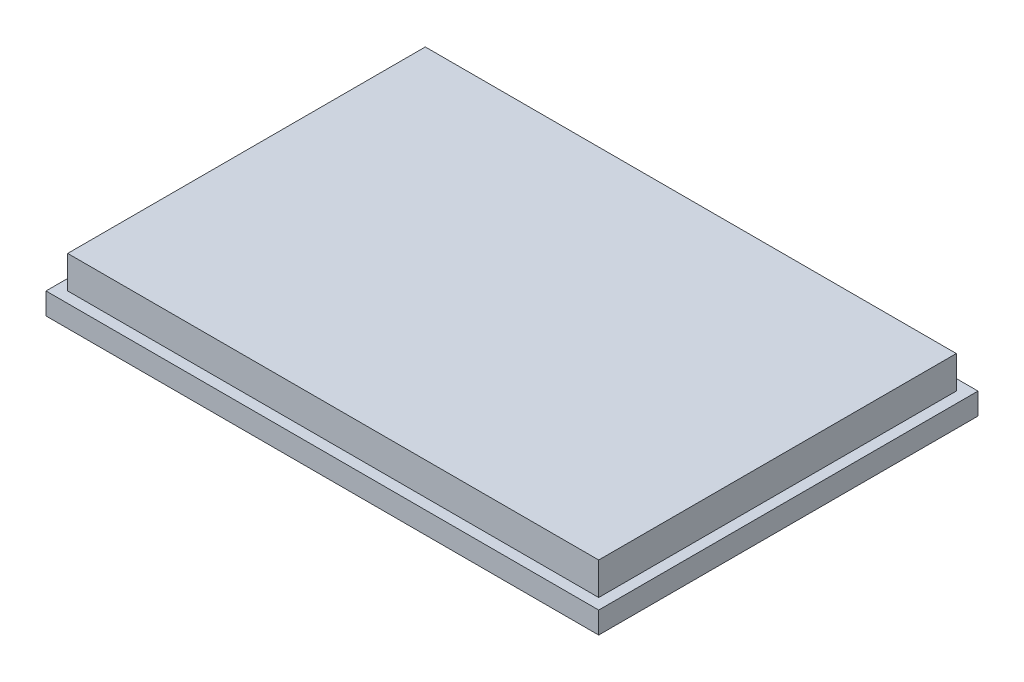
from build123d import *

# Parameters (mm, degrees)
SKETCH1_W           = 51
SKETCH1_H           = 35
BOSS_EXTRUDE1_DEPTH = 2
SKETCH2_W           = 49
SKETCH2_H           = 33
BOSS_EXTRUDE2_DEPTH = 3
SKETCH3_W           = 5.491242003
SKETCH3_H           = 3
BOSS_EXTRUDE3_DEPTH = 5
SKETCH4_R           = 1
CUT_EXTRUDE1_DEPTH  = 56.009090158


with BuildPart() as part:
    # Sketch1 → Boss-Extrude1 (new body)
    with BuildSketch(Plane(origin=(0, 0, 0), x_dir=(1, 0, 0), z_dir=(0, 1, 0))):
        with Locations((25.5, -17.5)):
            Rectangle(SKETCH1_W, SKETCH1_H)
    extrude(amount=BOSS_EXTRUDE1_DEPTH)

    # Sketch2 → Boss-Extrude2 (add)
    with BuildSketch(Plane(origin=(0, 2, 0), x_dir=(1, 0, 0), z_dir=(0, 1, 0))):
        with Locations((25.5, -17.5)):
            Rectangle(SKETCH2_W, SKETCH2_H)
    extrude(amount=BOSS_EXTRUDE2_DEPTH)

    # Sketch3 → Boss-Extrude3 (add)
    with BuildSketch(Plane.XZ):
        with Locations((27.834801154, 18.5)):
            Rectangle(SKETCH3_W, SKETCH3_H)
    extrude(amount=BOSS_EXTRUDE3_DEPTH)

    # Sketch4 → Cut-Extrude1 (cut, through all)
    with BuildSketch(Plane.XY.offset(20)):
        with Locations((27.560182347, -2.619839314)):
            Circle(SKETCH4_R)
    extrude(amount=-CUT_EXTRUDE1_DEPTH, mode=Mode.SUBTRACT)


solid = part.part
